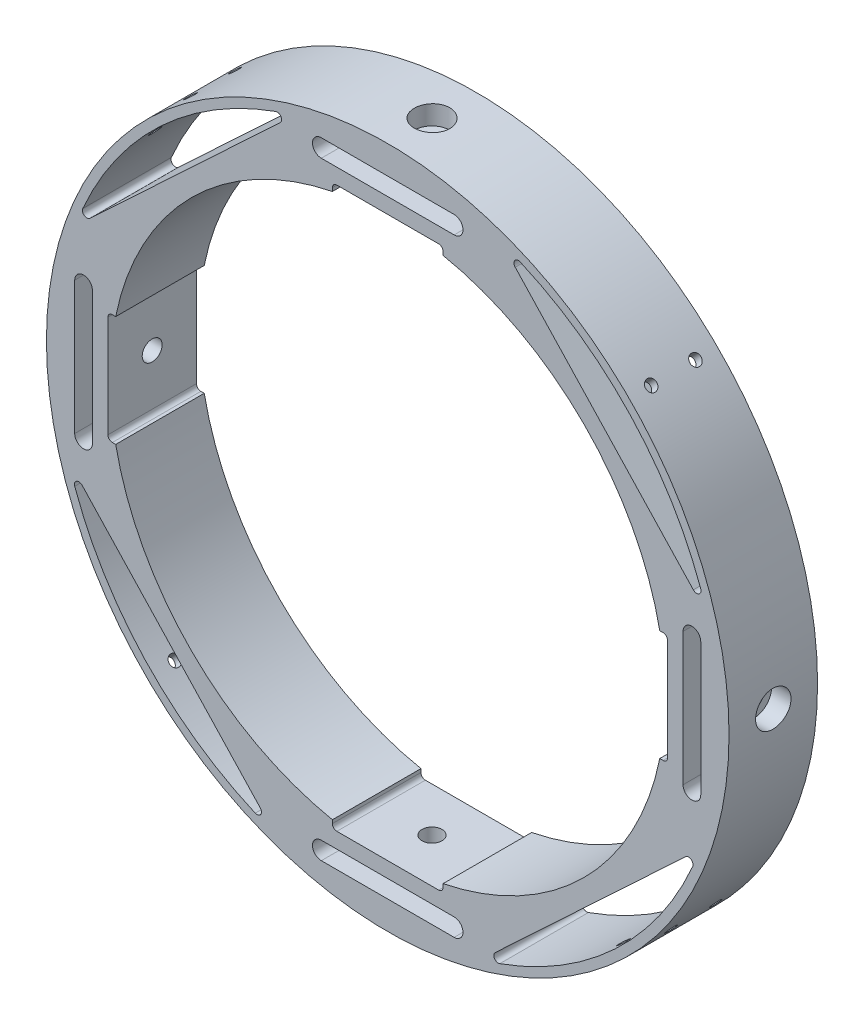
from build123d import *
from build123d.topology import SkipClean

# Parameters (mm, degrees)
SKETCH1_R                    = 77.1
BOSS_EXTRUDE1_DEPTH          = 20
CUT_EXTRUDE1_REACH           = 112.855
SKETCH2_R                    = 62.71
CUT_EXTRUDE2_DEPTH           = 111.854950273
CIRPATTERN1_COUNT            = 4
R_P_TITION_CIRCULAIRE2_COUNT = 4
SPLIT1_SURFACE_1_BACK        = 219.987
SPLIT1_SURFACE_1_DEPTH       = 439.974
SPLIT1_SURFACE_2_BACK        = 219.987
SPLIT1_SURFACE_2_DEPTH       = 439.974
CUT_EXTRUDE10_DEPTH          = 97.522614089
CUT_EXTRUDE10_DEPTH_BACK     = 20
CUT_EXTRUDE11_DEPTH          = 20
CIRPATTERN3_COUNT            = 4


# Read off the part's stored shape, not the designer's step: Répétition circulaire1, Répétition linéaire1
with BuildPart() as part:
    # Sketch1 → Boss-Extrude1 (new body)
    with BuildSketch(Plane.XY):
        Circle(SKETCH1_R)
    extrude(amount=BOSS_EXTRUDE1_DEPTH)

    # Sketch2 → Cut-Extrude1 (cut, up to next)
    with BuildSketch(Plane.XY.offset(20), mode=Mode.PRIVATE) as cut_extrude1_sk1:
        Circle(SKETCH2_R)
    cut_extrude1_tool1 = extrude(cut_extrude1_sk1.sketch, amount=-CUT_EXTRUDE1_REACH, mode=Mode.PRIVATE) & part.part
    add(cut_extrude1_tool1.solids().sort_by_distance((0, 0, 20))[0], mode=Mode.SUBTRACT)

    # Sketch39 → Cut-Extrude2 (cut, through all)
    with BuildSketch(Plane(origin=(0, 0, 0), x_dir=(-1, 0, 0), z_dir=(0, 0, -1))):
        with BuildLine():
            Line((-15, 70.71), (15, 70.71))
            ThreePointArc((15, 70.71), (17, 68.71), (15, 66.71))
            Line((15, 66.71), (-15, 66.71))
            ThreePointArc((-15, 66.71), (-17, 68.71), (-15, 70.71))
        make_face()
    cut_extrude2 = extrude(amount=-CUT_EXTRUDE2_DEPTH, mode=Mode.SUBTRACT)

    # CirPattern1: Cut-Extrude2 ×4 about axis
    cirpattern1_axis = Axis((0, 0, 0), (0, 0, 1))
    for i in range(1, CIRPATTERN1_COUNT):
        add(cut_extrude2.rotate(cirpattern1_axis, i * 360 / CIRPATTERN1_COUNT), mode=Mode.SUBTRACT)

    # Esquisse2 → Trou taraudé M31 (revolve, cut)
    with BuildSketch(Plane(origin=(49.558924707, -59.062026564, 5), x_dir=(0.766044443118979, 0.6427876096865381, 0), z_dir=(0, 0, 1))):
        Polygon((0, 0), (0, 8.751075774), (1.25, 8), (1.25, 0), align=None)
    revolve(axis=Axis((53.640626028, -63.926408778, 5), (-0.6427876096865383, 0.766044443118979, 0)), mode=Mode.SUBTRACT)

    # Esquisse2 at point 2 (carried to point 2, square into its face) → Trou taraudé M31 at 2 (revolve, cut)
    with BuildSketch(Plane(origin=(-54.517932829, -54.517932829, 5), x_dir=(0.707106781, -0.707106781, 0), z_dir=(0, 0, 1))):
        Polygon((0, 0), (0, 8.751075774), (1.25, 8), (1.25, 0), align=None)
    revolve(axis=Axis((-59.00806089, -59.00806089, 5), (0.707106781, 0.707106781, 0)), mode=Mode.SUBTRACT)

    # Esquisse2 at point 3 (carried to point 3, square into its face) → Trou taraudé M31 at 3 (revolve, cut)
    with BuildSketch(Plane(origin=(-59.062026564, 49.558924707, 5), x_dir=(-0.642788057, -0.766044068, 0), z_dir=(0, 0, 1))):
        Polygon((0, 0), (0, 8.751075774), (1.25, 8), (1.25, 0), align=None)
    revolve(axis=Axis((-63.926406395, 53.640628868, 5), (0.766044068, -0.642788057, 0)), mode=Mode.SUBTRACT)

    # Répétition circulaire1 outline → Répétition circulaire1 (revolve, cut)
    with BuildSketch(Plane(origin=(0, 0, 5), x_dir=(0.6427876096865404, 0.7660444431189772, 0), z_dir=(0, 0, -1))):
        Polygon((0, 68.348924226), (1.25, 69.1), (1.25, 77.100001399), (0, 77.100001399), align=None)
    revolve(axis=Axis((0, 0, 5), (0.7660444431189772, -0.6427876096865404, 0)), mode=Mode.SUBTRACT)

    # R_p_tition circulaire1 2 outline → R_p_tition circulaire1 2 (revolve, cut)
    with BuildSketch(Plane(origin=(0, 0, 5), x_dir=(0.707106781186546, -0.707106781186549, 0), z_dir=(0, 0, 1))):
        Polygon((0, 68.348924226), (1.25, 69.1), (1.25, 77.100001399), (0, 77.100001399), align=None)
    revolve(axis=Axis((0, 0, 5), (0.707106781186549, 0.707106781186546, 0)), mode=Mode.SUBTRACT)

    # R_p_tition circulaire1 3 outline → R_p_tition circulaire1 3 (revolve, cut)
    with BuildSketch(Plane(origin=(0, 0, 5), x_dir=(0.7660444431189789, 0.6427876096865381, 0), z_dir=(0, 0, -1))):
        Polygon((1.25, -77.100001399), (1.25, -69.1), (0, -68.348924226), (0, -77.100001399), align=None)
    revolve(axis=Axis((0, 0, 5), (0.6427876096865381, -0.7660444431189789, 0)), mode=Mode.SUBTRACT)

    # Répétition linéaire1 outline → Répétition linéaire1 (revolve, cut)
    with BuildSketch(Plane(origin=(0, 0, 15), x_dir=(0.6427876096865404, 0.7660444431189772, 0), z_dir=(0, 0, -1))):
        Polygon((1.25, -77.100001399), (1.25, -69.1), (0, -68.348924226), (0, -77.100001399), align=None)
        Polygon((0, 77.100001399), (0, 68.348924226), (1.25, 69.1), (1.25, 77.100001399), align=None)
    revolve(axis=Axis((0, 0, 15), (0.7660444431189772, -0.6427876096865404, 0)), mode=Mode.SUBTRACT)

    # R_p_tition lin_aire1 2 outline → R_p_tition lin_aire1 2 (revolve, cut)
    with BuildSketch(Plane(origin=(0, 0, 15), x_dir=(0.707106781186546, -0.707106781186549, 0), z_dir=(0, 0, 1))):
        Polygon((1.25, -77.100001399), (1.25, -69.1), (0, -68.348924226), (0, -77.100001399), align=None)
        Polygon((0, 77.100001399), (0, 68.348924226), (1.25, 69.1), (1.25, 77.100001399), align=None)
    revolve(axis=Axis((0, 0, 15), (0.707106781186549, 0.707106781186546, 0)), mode=Mode.SUBTRACT)

    # R_p_tition lin_aire1 3 outline → R_p_tition lin_aire1 3 (revolve, cut)
    with BuildSketch(Plane(origin=(0, 0, 15), x_dir=(0.7660444431189789, 0.6427876096865381, 0), z_dir=(0, 0, -1))):
        Polygon((0, 68.348924226), (1.25, 69.1), (1.25, 77.100001399), (0, 77.100001399), align=None)
        Polygon((1.25, -69.1), (0, -68.348924226), (0, -77.100001399), (1.25, -77.100001399), align=None)
    revolve(axis=Axis((0, 0, 15), (0.6427876096865381, -0.7660444431189789, 0)), mode=Mode.SUBTRACT)

    # Esquisse4 → Chambrage pour vis à six pans creux M41 (revolve, cut)
    with BuildSketch(Plane(origin=(0, 77.1, 10), x_dir=(0, 0, 1), z_dir=(1, 0, 0))):
        Polygon((0, 0), (0, 29.851936393), (2.25, 28.5), (2.25, 4.4), (4, 4.4), (4, 0), align=None)
    chambrage_pour_vis_six_pans_creux_m41 = revolve(axis=Axis((0, 83.45, 10), (0, -1, 0)), mode=Mode.SUBTRACT)

    # Répétition circulaire2: Chambrage pour vis à six pans creux M41 ×4 about axis
    r_p_tition_circulaire2_axis = Axis((0, 0, 0), (0, 0, 1))
    for i in range(1, R_P_TITION_CIRCULAIRE2_COUNT):
        add(chambrage_pour_vis_six_pans_creux_m41.rotate(r_p_tition_circulaire2_axis, i * 360 / R_P_TITION_CIRCULAIRE2_COUNT), mode=Mode.SUBTRACT)


with BuildPart() as body_2:
    # Split1: the piece behind the surface
    add(part.part)
    # Split1 surface: a surface, the sketch's curves swept straight by 439.974 mm
    with BuildLine(Plane(origin=(0, 0, 0), x_dir=(-1, 0, 0), z_dir=(0, 0, -1)).offset(-SPLIT1_SURFACE_1_BACK), mode=Mode.PRIVATE) as split1_surface_1_path:
        Line((54.517932829, 54.517932829), (0, 0))
        Line((0, 0), (54.517932829, -54.517932829))
    split1_surface_1 = Shell.extrude(split1_surface_1_path.wire(), (0 * SPLIT1_SURFACE_1_DEPTH, 0 * SPLIT1_SURFACE_1_DEPTH, -1 * SPLIT1_SURFACE_1_DEPTH))
    split(bisect_by=split1_surface_1, keep=Keep.BOTTOM)


with BuildPart() as part_1:
    add(part.part)

    # Split1: split by a surface, the side it looks to stays
    # Split1 surface: a surface, the sketch's curves swept straight by 439.974 mm
    with BuildLine(Plane(origin=(0, 0, 0), x_dir=(-1, 0, 0), z_dir=(0, 0, -1)).offset(-SPLIT1_SURFACE_2_BACK), mode=Mode.PRIVATE) as split1_surface_2_path:
        Line((54.517932829, 54.517932829), (0, 0))
        Line((0, 0), (54.517932829, -54.517932829))
    split1_surface_2 = Shell.extrude(split1_surface_2_path.wire(), (0 * SPLIT1_SURFACE_2_DEPTH, 0 * SPLIT1_SURFACE_2_DEPTH, -1 * SPLIT1_SURFACE_2_DEPTH))
    split(bisect_by=split1_surface_2, keep=Keep.TOP)

    # Sketch57 → Cut-Extrude10 (cut, two sides: drawn at the far end of the back side and taken through both)
    with BuildSketch(Plane.XY.offset(20).offset(-CUT_EXTRUDE10_DEPTH_BACK)):
        with BuildLine():
            Line((-63.21, 11.5), (-63.21, -11.5))
            ThreePointArc((-63.21, -11.5), (-62.917106781, -12.207106781), (-62.21, -12.5))
            Line((-62.21, -12.5), (-61.451558971, -12.5))
            ThreePointArc((-61.451558971, -12.5), (-62.71, 0), (-61.451558971, 12.5))
            Line((-61.451558971, 12.5), (-62.21, 12.5))
            ThreePointArc((-62.21, 12.5), (-62.917106781, 12.207106781), (-63.21, 11.5))
        make_face()
    extrude(amount=CUT_EXTRUDE10_DEPTH + CUT_EXTRUDE10_DEPTH_BACK, mode=Mode.SUBTRACT)

    # Mirror5: part across plane


with BuildPart() as part_2:
    with SkipClean():  # the faces are left unmerged after this step: merging them gives an invalid solid
        add(part_1.part)
        add(part_1.part.mirror(Plane(origin=(0, 0, 20.01), x_dir=(0, 0, 1), z_dir=(-0.7071067811865488, 0.7071067811865464, 0))))

    # Mirror6: part across plane


with BuildPart() as part_3:
    add(part_2.part)
    add(part_2.part.mirror(Plane(origin=(0, 0, 20.01), x_dir=(0, 0, 1), z_dir=(-0.7071067811865438, -0.7071067811865513, 0))))

    # Sketch61 → Cut-Extrude11 (cut)
    with BuildSketch(Plane(origin=(0, 0, 0), x_dir=(-1, 0, 0), z_dir=(0, 0, -1))):
        with BuildLine():
            Line((24.289256757, 69.035078085), (67.279472136, 28.797267736))
            ThreePointArc((67.279472136, 28.797267736), (68.539091305, 28.710100808), (68.879997929, 29.92583976))
            ThreePointArc((68.879997929, 29.92583976), (51.319489104, 54.829919188), (25.3096177, 70.706670491))
            ThreePointArc((25.3096177, 70.706670491), (24.119058448, 70.286186018), (24.289256757, 69.035078085))
        make_face()
    cut_extrude11 = extrude(amount=-CUT_EXTRUDE11_DEPTH, mode=Mode.SUBTRACT)

    # CirPattern3: Cut-Extrude11 ×4 about axis
    cirpattern3_axis = Axis((0, 0, 0), (0, 0, 1))
    for i in range(1, CIRPATTERN3_COUNT):
        add(cut_extrude11.rotate(cirpattern3_axis, i * 360 / CIRPATTERN3_COUNT), mode=Mode.SUBTRACT)


solid = part_3.part
